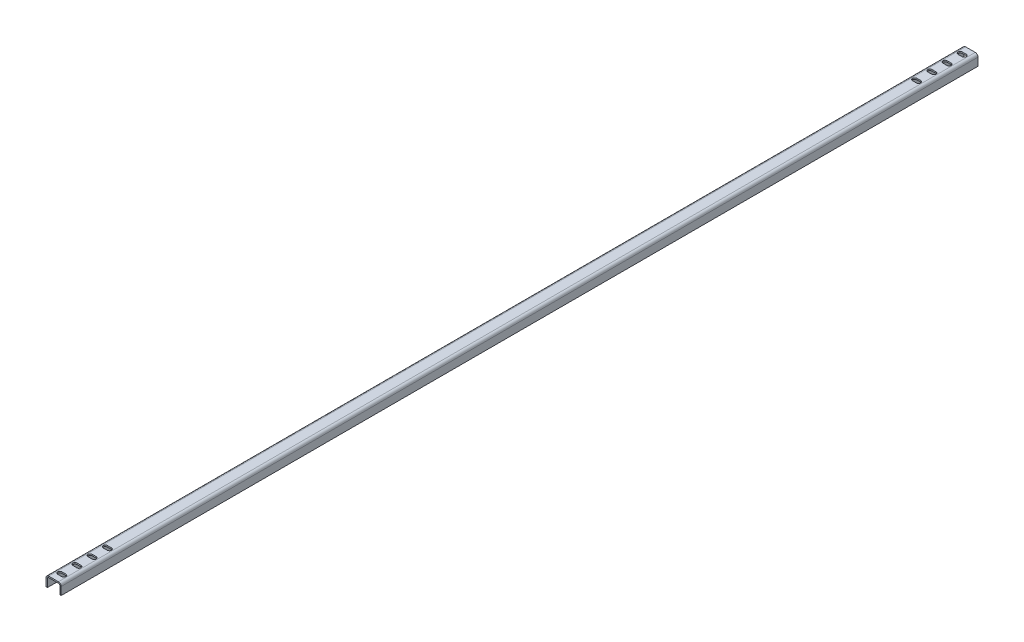
from build123d import *

# Parameters (mm, degrees)
BASE_FLANGE1_DEPTH = 3020
CUT_EXTRUDE1_DEPTH = 3021.616658896


# Sheet-metal steps are written as plain solids
with BuildPart() as part:
    # Sketch1 → Base-Flange1 (new body)
    with BuildSketch(Plane.XY):
        with BuildLine():
            Line((0, 0), (0, 26))
            ThreePointArc((0, 26), (2.636038969, 32.363961031), (9, 35))
            Line((9, 35), (41, 35))
            ThreePointArc((41, 35), (47.363961031, 32.363961031), (50, 26))
            Line((50, 26), (50, 0))
            Line((50, 0), (45.5, 0))
            Line((45.5, 0), (45.5, 26))
            ThreePointArc((45.5, 26), (44.181980515, 29.181980515), (41, 30.5))
            Line((41, 30.5), (9, 30.5))
            ThreePointArc((9, 30.5), (5.818019485, 29.181980515), (4.5, 26))
            Line((4.5, 26), (4.5, 0))
            Line((4.5, 0), (0, 0))
        make_face()
    extrude(amount=BASE_FLANGE1_DEPTH)

    # Sketch6 → Cut-Extrude1 (cut, through all)
    with BuildSketch(Plane(origin=(0, 35, 0), x_dir=(1, 0, 0), z_dir=(0, 1, 0))):
        with BuildLine():
            Line((18.5, -2986), (31.5, -2986))
            ThreePointArc((31.5, -2986), (38.5, -2993), (31.5, -3000))
            Line((31.5, -3000), (18.5, -3000))
            ThreePointArc((18.5, -3000), (11.5, -2993), (18.5, -2986))
        make_face()
        with BuildLine():
            Line((18.5, -2936), (31.5, -2936))
            ThreePointArc((31.5, -2936), (38.5, -2943), (31.5, -2950))
            Line((31.5, -2950), (18.5, -2950))
            ThreePointArc((18.5, -2950), (11.5, -2943), (18.5, -2936))
        make_face()
        with BuildLine():
            Line((18.5, -2886), (31.5, -2886))
            ThreePointArc((31.5, -2886), (38.5, -2893), (31.5, -2900))
            Line((31.5, -2900), (18.5, -2900))
            ThreePointArc((18.5, -2900), (11.5, -2893), (18.5, -2886))
        make_face()
        with BuildLine():
            Line((18.5, -2836), (31.5, -2836))
            ThreePointArc((31.5, -2836), (38.5, -2843), (31.5, -2850))
            Line((31.5, -2850), (18.5, -2850))
            ThreePointArc((18.5, -2850), (11.5, -2843), (18.5, -2836))
        make_face()
        with BuildLine():
            Line((18.5, -34), (31.5, -34))
            ThreePointArc((31.5, -34), (38.5, -27), (31.5, -20))
            Line((31.5, -20), (18.5, -20))
            ThreePointArc((18.5, -20), (11.5, -27), (18.5, -34))
        make_face()
        with BuildLine():
            Line((18.5, -84), (31.5, -84))
            ThreePointArc((31.5, -84), (38.5, -77), (31.5, -70))
            Line((31.5, -70), (18.5, -70))
            ThreePointArc((18.5, -70), (11.5, -77), (18.5, -84))
        make_face()
        with BuildLine():
            Line((18.5, -134), (31.5, -134))
            ThreePointArc((31.5, -134), (38.5, -127), (31.5, -120))
            Line((31.5, -120), (18.5, -120))
            ThreePointArc((18.5, -120), (11.5, -127), (18.5, -134))
        make_face()
        with BuildLine():
            Line((18.5, -184), (31.5, -184))
            ThreePointArc((31.5, -184), (38.5, -177), (31.5, -170))
            Line((31.5, -170), (18.5, -170))
            ThreePointArc((18.5, -170), (11.5, -177), (18.5, -184))
        make_face()
    extrude(amount=-CUT_EXTRUDE1_DEPTH, mode=Mode.SUBTRACT)


solid = part.part
